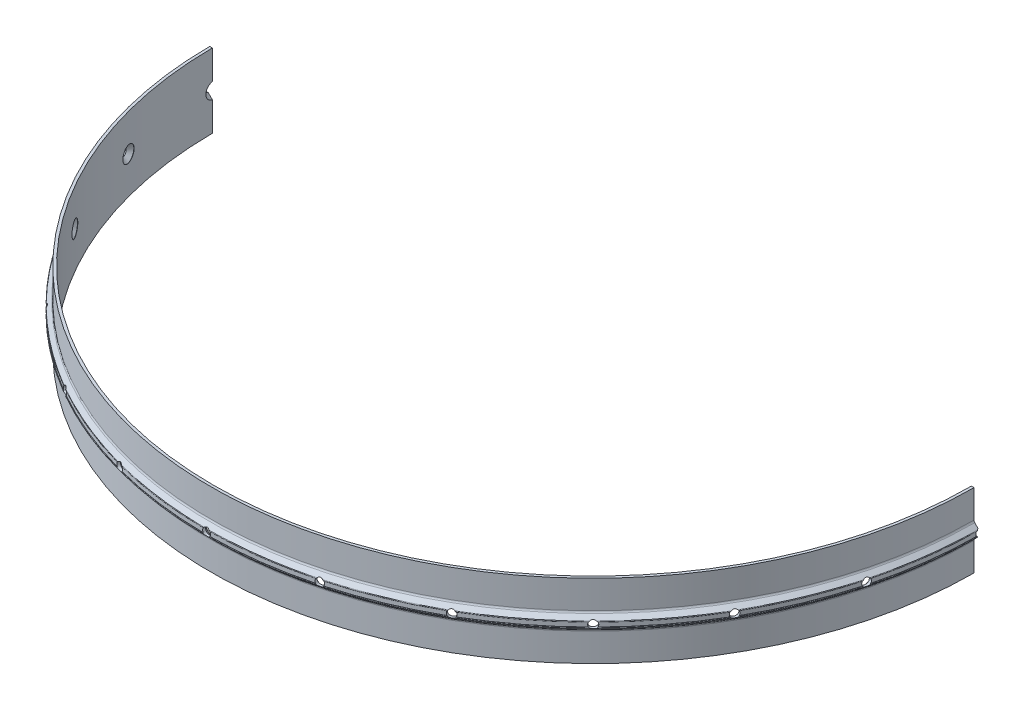
from build123d import *

# Parameters (mm, degrees)
REVOLVE1_ANGLE                             = 180
SKETCH2_R                                  = 1.5
CUT_EXTRUDE2_DEPTH                         = 211.180996586
SKETCH3_R                                  = 3
CUT_EXTRUDE3_DEPTH                         = 143.764
CHAMFER1_SIZE                              = 1.5
FILLET1_R                                  = 0.250000008
FILLET2_R                                  = 1
CIRPATTERN1_COUNT                          = 7
CIRPATTERN1_ANGLE                          = 90
CHAMFER1_OF_CIRPATTERN1_SIZE               = 1.5
CIRPATTERN1_THE_OTHER_WAY_COUNT            = 7
CIRPATTERN1_THE_OTHER_WAY_ANGLE            = 90
CHAMFER1_OF_CIRPATTERN1_THE_OTHER_WAY_SIZE = 1.5
SKETCH4_W                                  = 340.266155201
SKETCH4_H                                  = 1
CUT_EXTRUDE4_DEPTH                         = 210.08604864


# Some blends are built 0.0001 mm under size
with BuildPart() as part:
    # Sketch1 → Revolve1 (revolve)
    with BuildSketch(Plane.XY):
        Polygon((144.7, 34.35), (144.7, 23.285786438), (146.622182541, 21.363603897), (146.4, 21.141421356), (146.4, 19.558578644), (146.622182541, 19.336396103), (144.7, 17.414213562), (144.7, 6.35), (143.7, 6.35), (143.7, 34.35), align=None)
    revolve(axis=Axis((0, 0, 0), (0, -1, 0)), revolution_arc=REVOLVE1_ANGLE)

    # Sketch2 → Cut-Extrude2 (cut, through all)
    with BuildSketch(Plane.XY):
        with Locations(Location((0, 20.35, 0), (0, 0, 180))):
            Circle(SKETCH2_R)
    cut_extrude2 = extrude(amount=CUT_EXTRUDE2_DEPTH, mode=Mode.SUBTRACT)

    # Sketch3 → Cut-Extrude3 (cut)
    with BuildSketch(Plane.XY):
        with Locations(Location((0, 20.35, 0), (0, 0, 180))):
            Circle(SKETCH3_R)
    cut_extrude3 = extrude(amount=CUT_EXTRUDE3_DEPTH, mode=Mode.SUBTRACT)

    # Chamfer1
    chamfer1_edges = [part.edges().sort_by_distance(p)[0] for p in [
        (1.5, 20.35, 143.764),
    ]]
    chamfer(chamfer1_edges, length=CHAMFER1_SIZE - 0.0001)  # a hair under: the kernel refuses the full size

    # Fillet1
    # the kernel refuses this fillet: 0.250000008 mm, written as the material it takes off along each edge
    with BuildSketch(Plane(origin=(0, 21.363603897, 0), x_dir=(0.9999909076623271, 0, -0.004264339652875339), z_dir=(-0.004264339652875339, 0, -0.9999909076623271))) as fillet1_piece_1:
        with BuildLine():
            CenterArc((146.622182541 - FILLET1_R * 1.41421356237, 0), FILLET1_R, 315, 90)
            Line((146.622182541 - FILLET1_R * 0.707106781187, FILLET1_R * 0.707106781187), (146.622182541, 0))
            Line((146.622182541, 0), (146.622182541 - FILLET1_R * 0.707106781187, -FILLET1_R * 0.707106781187))
        make_face()
    revolve(axis=Axis((0, 21.363603897, 0), (0, -1, 0)), revolution_arc=90.056572474, mode=Mode.SUBTRACT)
    with BuildSketch(Plane(origin=(0, 19.336396103, 0), x_dir=(0.9999909076623271, 0, -0.0042643396528762355), z_dir=(-0.0042643396528762355, 0, -0.9999909076623271))) as fillet1_piece_2:
        with BuildLine():
            CenterArc((146.622182541 - FILLET1_R * 1.41421356237, 0), FILLET1_R, 315, 90)
            Line((146.622182541 - FILLET1_R * 0.707106781187, -FILLET1_R * 0.707106781187), (146.622182541, 0))
            Line((146.622182541, 0), (146.622182541 - FILLET1_R * 0.707106781187, FILLET1_R * 0.707106781187))
        make_face()
    revolve(axis=Axis((0, 19.336396103, 0), (0, -1, 0)), revolution_arc=90.056572474, mode=Mode.SUBTRACT)
    with BuildSketch(Plane(origin=(0, 19.336396103, 0), x_dir=(-0.003276970777606628, 0, 0.9999946307168468), z_dir=(0.9999946307168468, 0, 0.003276970777606628))) as fillet1_piece_3:
        with BuildLine():
            CenterArc((146.622182541 - FILLET1_R * 1.41421356237, 0), FILLET1_R, 315, 90)
            Line((146.622182541 - FILLET1_R * 0.707106781187, FILLET1_R * 0.707106781187), (146.622182541, 0))
            Line((146.622182541, 0), (146.622182541 - FILLET1_R * 0.707106781187, -FILLET1_R * 0.707106781187))
        make_face()
    revolve(axis=Axis((0, 19.336396103, 0), (0, -1, 0)), revolution_arc=90.056572474, mode=Mode.SUBTRACT)
    with BuildSketch(Plane(origin=(0, 21.363603897, 0), x_dir=(-0.0032769707776130674, 0, 0.9999946307168468), z_dir=(0.9999946307168468, 0, 0.0032769707776130674))) as fillet1_piece_4:
        with BuildLine():
            CenterArc((146.622182541 - FILLET1_R * 1.41421356237, 0), FILLET1_R, 315, 90)
            Line((146.622182541 - FILLET1_R * 0.707106781187, -FILLET1_R * 0.707106781187), (146.622182541, 0))
            Line((146.622182541, 0), (146.622182541 - FILLET1_R * 0.707106781187, FILLET1_R * 0.707106781187))
        make_face()
    revolve(axis=Axis((0, 21.363603897, 0), (0, -1, 0)), revolution_arc=90.056572474, mode=Mode.SUBTRACT)

    # Fillet2
    fillet2_edges = [part.edges().sort_by_distance(p)[0] for p in [
        (0, 23.285786438, 144.7),
        (0, 17.414213562, 144.7),
    ]]
    fillet(fillet2_edges, radius=FILLET2_R)

    # CirPattern1: Cut-Extrude2, Cut-Extrude3 ×7 about axis
    cirpattern1_axis = Axis((0, 0, 0), (0, 1, 0))
    add([cut_extrude2.rotate(cirpattern1_axis, i * CIRPATTERN1_ANGLE / (CIRPATTERN1_COUNT - 1)) for i in range(1, CIRPATTERN1_COUNT)], mode=Mode.SUBTRACT)
    add([cut_extrude3.rotate(cirpattern1_axis, i * CIRPATTERN1_ANGLE / (CIRPATTERN1_COUNT - 1)) for i in range(1, CIRPATTERN1_COUNT)], mode=Mode.SUBTRACT)

    # Chamfer1 of CirPattern1
    chamfer1_of_cirpattern1_edges = [part.edges().sort_by_distance(p)[0] for p in [
        (38.65774994, 20.35, 138.477131923),
        (73.181038106, 20.35, 123.75327615),
        (102.717159462, 20.35, 100.595839119),
        (125.25327615, 20.35, 70.582961894),
        (139.253589058, 20.35, 35.759972461),
        (143.764, 20.35, 1.5),
    ]]
    chamfer(chamfer1_of_cirpattern1_edges, length=CHAMFER1_OF_CIRPATTERN1_SIZE - 0.0001)  # a hair under: the kernel refuses the full size

    # CirPattern1 the other way: Cut-Extrude2, Cut-Extrude3 ×7 about axis
    cirpattern1_the_other_way_axis = Axis((0, 0, 0), (0, -1, 0))
    add([cut_extrude2.rotate(cirpattern1_the_other_way_axis, i * CIRPATTERN1_THE_OTHER_WAY_ANGLE / (CIRPATTERN1_THE_OTHER_WAY_COUNT - 1)) for i in range(1, CIRPATTERN1_THE_OTHER_WAY_COUNT)], mode=Mode.SUBTRACT)
    add([cut_extrude3.rotate(cirpattern1_the_other_way_axis, i * CIRPATTERN1_THE_OTHER_WAY_ANGLE / (CIRPATTERN1_THE_OTHER_WAY_COUNT - 1)) for i in range(1, CIRPATTERN1_THE_OTHER_WAY_COUNT)], mode=Mode.SUBTRACT)

    # Chamfer1 of CirPattern1 the other way
    chamfer1_of_cirpattern1_the_other_way_edges = [part.edges().sort_by_distance(p)[0] for p in [
        (-35.759972461, 20.35, 139.253589058),
        (-70.582961894, 20.35, 125.25327615),
        (-100.595839119, 20.35, 102.717159462),
        (-123.75327615, 20.35, 73.181038106),
        (-138.477131923, 20.35, 38.65774994),
        (-143.764, 20.35, 1.5),
    ]]
    chamfer(chamfer1_of_cirpattern1_the_other_way_edges, length=CHAMFER1_OF_CIRPATTERN1_THE_OTHER_WAY_SIZE - 0.0001)  # a hair under: the kernel refuses the full size

    # Sketch4 → Cut-Extrude4 (cut, through all)
    with BuildSketch(Plane(origin=(0, 34.35, 0), x_dir=(1, 0, 0), z_dir=(0, 1, 0))):
        with Locations((-5.868950494, 0)):
            Rectangle(SKETCH4_W, SKETCH4_H)
    extrude(amount=-CUT_EXTRUDE4_DEPTH, mode=Mode.SUBTRACT)


solid = part.part
